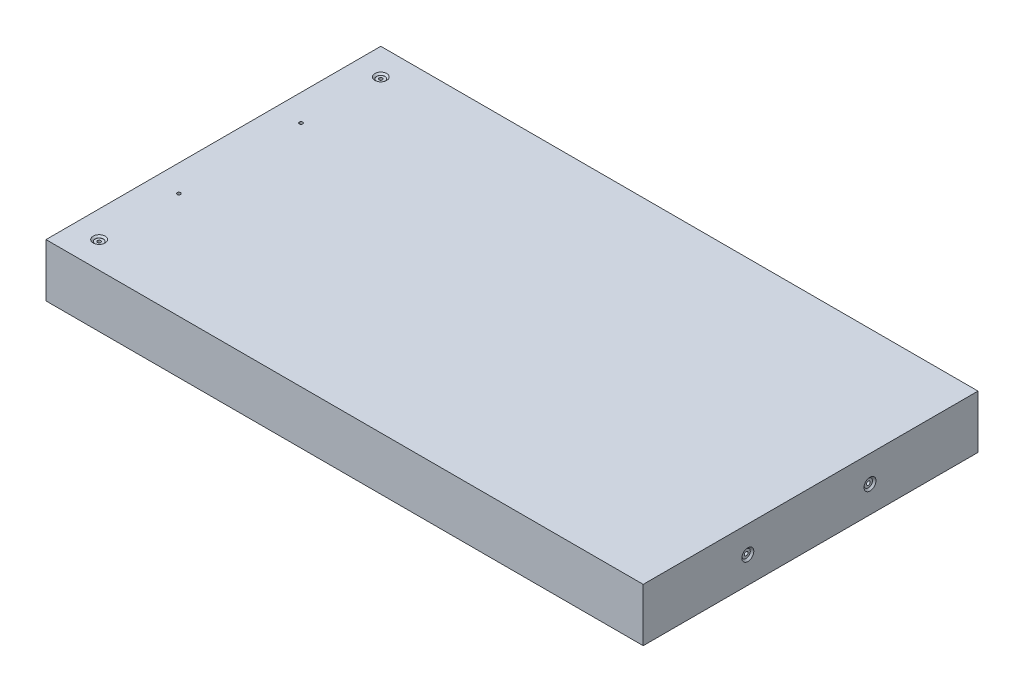
from build123d import *

# Parameters (mm, degrees)
SKETCH1_W                                   = 285.4
SKETCH1_H                                   = 160
BOSS_EXTRUDE1_DEPTH                         = 25.4
CBORE_FOR_0_BINDING_HEAD_MACHINE_SC_2_COUNT = 2
CBORE_FOR_0_BINDING_HEAD_MACHINE_SC_2_PITCH = 58.4
CBORE_FOR_0_BINDING_HEAD_MACHINE_SC_3_COUNT = 2
CBORE_FOR_0_BINDING_HEAD_MACHINE_SC_3_PITCH = 134.6
CBORE_FOR_0_BINDING_HEAD_MACHINE_SC_4_COUNT = 2
CBORE_FOR_0_BINDING_HEAD_MACHINE_SC_4_PITCH = 58.4


with BuildPart() as part:
    # Sketch1 → Boss-Extrude1 (new body)
    with BuildSketch(Plane(origin=(0, 0, 0), x_dir=(1, 0, 0), z_dir=(0, 1, 0))):
        Rectangle(SKETCH1_W, SKETCH1_H)
    extrude(amount=BOSS_EXTRUDE1_DEPTH)

    # Sketch3 → CBORE for #0 Binding Head Machine Screw3 (revolve, cut)
    with BuildSketch(Plane(origin=(142.7, 12.7, 30), x_dir=(0, 0, -1), z_dir=(0, 1, 0))):
        Polygon((0, 0), (0, 30.53416509), (0.889, 30), (0.889, 0.8128), (1.98501, 0.8128), (1.98501, 0.87249), (2.8575, 0), align=None)
    cbore_for_0_binding_head_machine_screw3 = revolve(axis=Axis((149.05, 12.7, 30), (-1, 0, 0)), mode=Mode.SUBTRACT)

    # CBORE for _0 Binding Head Machine Sc 2: CBORE for #0 Binding Head Machine Screw3 ×2
    with Locations(*[(0, 0, -i * CBORE_FOR_0_BINDING_HEAD_MACHINE_SC_2_PITCH) for i in range(1, CBORE_FOR_0_BINDING_HEAD_MACHINE_SC_2_COUNT)]):
        add(cbore_for_0_binding_head_machine_screw3, mode=Mode.SUBTRACT)

    # Sketch7 → CBORE for #0 Binding Head Machine Screw1 (revolve, cut)
    with BuildSketch(Plane(origin=(-130, 25.4, 67.3), x_dir=(0, 0, 1), z_dir=(1, 0, 0))):
        Polygon((0, 0), (0, 25.4), (0.80645, 25.4), (0.80645, 0.8128), (1.98501, 0.8128), (1.98501, 0.732106037), (2.8575, 0), align=None)
    cbore_for_0_binding_head_machine_screw1 = revolve(axis=Axis((-130, 31.75, 67.3), (0, -1, 0)), mode=Mode.SUBTRACT)

    # CBORE for _0 Binding Head Machine Sc 3: CBORE for #0 Binding Head Machine Screw1 ×2
    with Locations(*[(0, 0, -i * CBORE_FOR_0_BINDING_HEAD_MACHINE_SC_3_PITCH) for i in range(1, CBORE_FOR_0_BINDING_HEAD_MACHINE_SC_3_COUNT)]):
        add(cbore_for_0_binding_head_machine_screw1, mode=Mode.SUBTRACT)

    # Sketch9 → CBORE for #0 Binding Head Machine Screw2 (revolve, cut)
    with BuildSketch(Plane(origin=(-130, 0, -29.2), x_dir=(0, 0, -1), z_dir=(1, 0, 0))):
        Polygon((0, 0), (0, 25.4), (0.80645, 25.4), (0.80645, 0.8128), (1.98501, 0.8128), (1.98501, 0.732106037), (2.8575, 0), align=None)
    cbore_for_0_binding_head_machine_screw2 = revolve(axis=Axis((-130, -6.35, -29.2), (0, 1, 0)), mode=Mode.SUBTRACT)

    # CBORE for _0 Binding Head Machine Sc 4: CBORE for #0 Binding Head Machine Screw2 ×2
    with Locations(*[(0, 0, i * CBORE_FOR_0_BINDING_HEAD_MACHINE_SC_4_PITCH) for i in range(1, CBORE_FOR_0_BINDING_HEAD_MACHINE_SC_4_COUNT)]):
        add(cbore_for_0_binding_head_machine_screw2, mode=Mode.SUBTRACT)


solid = part.part
